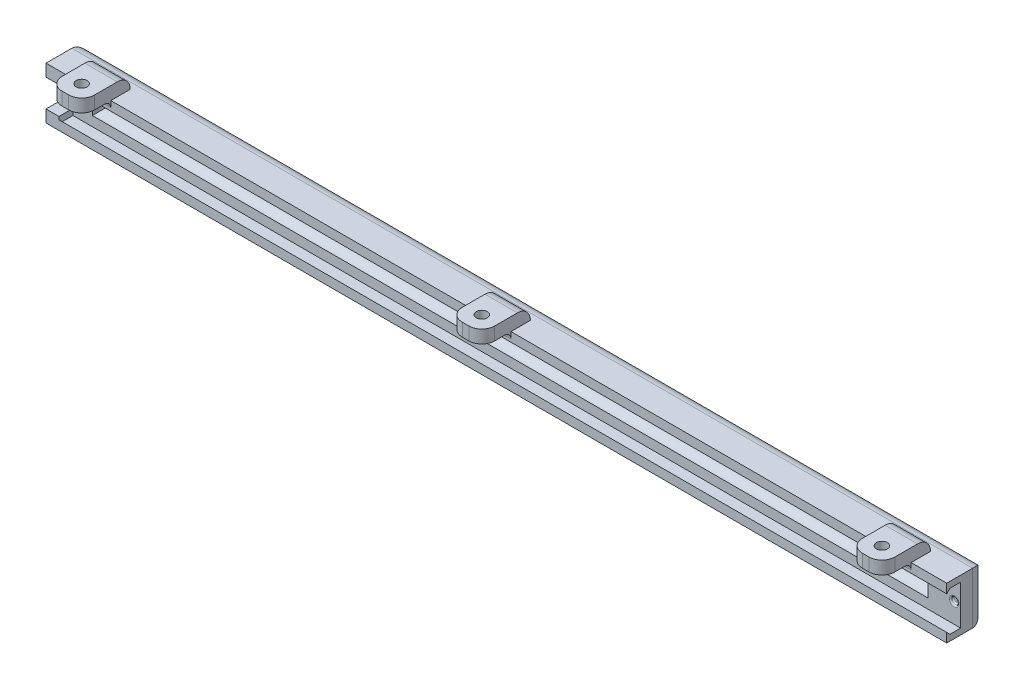
from build123d import *

# Parameters (mm, degrees)
SKETCH1_W               = 278
SKETCH1_H               = 16
BOSS_EXTRUDE1_DEPTH     = 6
CUT_EXTRUDE1_DEPTH      = 283.034214474
CUT_EXTRUDE1_DEPTH_BACK = 274
SKETCH3_W               = 4.3
SKETCH3_H               = 12.3
SKETCH13_W              = 10
SKETCH13_H              = 15
BOSS_EXTRUDE5_DEPTH     = 4
FILLET10_R              = 4
SKETCH14_R              = 1.7
CUT_EXTRUDE5_DEPTH      = 4
FILLET11_R              = 4
FILLET12_R              = 4
FILLET22_R              = 2
SKETCH17_W              = 278
SKETCH17_H              = 16
BOSS_EXTRUDE6_DEPTH     = 6
FILLET25_R              = 4
SKETCH18_R              = 1
CUT_EXTRUDE6_DEPTH      = 0.7
FILLET26_R              = 0.5
FILLET27_R              = 0.5
SKETCH21_W              = 4
SKETCH21_H              = 8.5
CUT_EXTRUDE10_DEPTH     = 4
BOSS_EXTRUDE9_DEPTH     = 274
SKETCH27_W              = 258
SKETCH27_H              = 6.3
CUT_EXTRUDE11_DEPTH     = 3
FILLET30_R              = 3.15
LPATTERN2_START         = 47.151862464
LPATTERN2_OUTLINE_R     = 1.7
LPATTERN2_DEPTH         = 4
LPATTERN2_START_2       = -24.03008596
LPATTERN2_2_DEPTH       = 10
LPATTERN2_START_3       = 99.46991404
LPATTERN2_3_DEPTH       = 10


with BuildPart() as part:
    # Sketch1 → Boss-Extrude1 (new body)
    with BuildSketch(Plane.XY):
        with Locations((-18.53008596, 39.151862464)):
            Rectangle(SKETCH1_W, SKETCH1_H)
    extrude(amount=BOSS_EXTRUDE1_DEPTH)

    # Sketch3 → Cut-Extrude1 (cut, two sides: drawn at the far end of the back side and taken through both)
    with BuildSketch(Plane(origin=(120.46991404, 0, 0), x_dir=(0, 0, -1), z_dir=(1, 0, 0)).offset(-CUT_EXTRUDE1_DEPTH_BACK)):
        with Locations((-3.85, 39.151862464)):
            Rectangle(SKETCH3_W, SKETCH3_H)
    extrude(amount=CUT_EXTRUDE1_DEPTH + CUT_EXTRUDE1_DEPTH_BACK, mode=Mode.SUBTRACT)

    # Sketch13 → Boss-Extrude5 (add)
    with BuildSketch(Plane(origin=(0, 47.151862464, 0), x_dir=(1, 0, 0), z_dir=(0, 1, 0))):
        with Locations((-142.53008596, -7.5)):
            Rectangle(SKETCH13_W, SKETCH13_H)
    extrude(amount=BOSS_EXTRUDE5_DEPTH)

    # Fillet10
    fillet10_edges = [part.edges().sort_by_distance(p)[0] for p in [
        (-142.53008596, 51.151862464, 0),
    ]]
    fillet(fillet10_edges, radius=FILLET10_R)

    # Sketch14 → Cut-Extrude5 (cut)
    with BuildSketch(Plane.XZ.offset(-47.151862464)):
        with Locations(Location((-142.53008596, 10, 0), (0, 0, 270))):
            Circle(SKETCH14_R)
    extrude(amount=-CUT_EXTRUDE5_DEPTH, mode=Mode.SUBTRACT)

    # Fillet11
    fillet11_edges = [part.edges().sort_by_distance(p)[0] for p in [
        (-137.53008596, 49.151862464, 15),
    ]]
    fillet(fillet11_edges, radius=FILLET11_R)

    # Fillet12
    fillet12_edges = [part.edges().sort_by_distance(p)[0] for p in [
        (-147.53008596, 49.151862464, 15),
    ]]
    fillet(fillet12_edges, radius=FILLET12_R)

    # Fillet22
    # the kernel refuses this fillet: 2 mm, written as the material it adds along each edge
    with BuildSketch(Plane(origin=(-147.53008596, 47.151862464, 6), x_dir=(0, 0, 1), z_dir=(1, 0, 0))) as fillet22_piece_1:
        with BuildLine():
            CenterArc((1.994367068, 2), FILLET22_R, 184.301222305, 85.698777695)
            Line((0, 1.85), (0, 0))
            Line((0, 0), (1.994367068, 0))
        make_face()
    extrude(amount=10)

    # Sketch17 → Boss-Extrude6 (add)
    with BuildSketch(Plane(origin=(0, 0, 0), x_dir=(-1, 0, 0), z_dir=(0, 0, -1))):
        with Locations((18.53008596, 39.151862464)):
            Rectangle(SKETCH17_W, SKETCH17_H)
    extrude(amount=BOSS_EXTRUDE6_DEPTH)

    # Fillet25
    fillet25_edges = [part.edges().sort_by_distance(p)[0] for p in [
        (120.46991404, 39.151862464, -6),
        (-18.53008596, 31.151862464, -6),
        (-157.53008596, 39.151862464, -6),
        (-18.53008596, 47.151862464, -6),
    ]]
    fillet(fillet25_edges, radius=FILLET25_R)

    # Sketch18 → Cut-Extrude6 (cut)
    with BuildSketch(Plane.XY.offset(1.7)):
        with Locations((118.46991404, 39.151862464)):
            Circle(SKETCH18_R)
    extrude(amount=-CUT_EXTRUDE6_DEPTH, mode=Mode.SUBTRACT)

    # Fillet26
    fillet26_edges = [part.edges().sort_by_distance(p)[0] for p in [
        (117.46991404, 39.151862464, 1.7),
    ]]
    fillet(fillet26_edges, radius=FILLET26_R)

    # Fillet27
    fillet27_edges = [part.edges().sort_by_distance(p)[0] for p in [
        (117.46991404, 39.151862464, 1),
    ]]
    fillet(fillet27_edges, radius=FILLET27_R)

    # Sketch21 → Cut-Extrude10 (cut)
    with BuildSketch(Plane.ZY.offset(157.53008596)):
        with Locations((4, 39.151862464)):
            Rectangle(SKETCH21_W, SKETCH21_H)
    extrude(amount=-CUT_EXTRUDE10_DEPTH, mode=Mode.SUBTRACT)

    # Sketch26 → Boss-Extrude9 (add)
    with BuildSketch(Plane(origin=(120.46991404, 0, 0), x_dir=(0, 0, -1), z_dir=(1, 0, 0))):
        Polygon((-6, 45.301862464), (-6, 44.301862464), (-5, 45.301862464), align=None)
        Polygon((-6, 33.001862464), (-6, 34.001862464), (-5, 33.001862464), align=None)
    extrude(amount=-BOSS_EXTRUDE9_DEPTH)

    # Sketch27 → Cut-Extrude11 (cut)
    with BuildSketch(Plane.XY.offset(1.7)):
        with Locations((-18.53008596, 39.151862464)):
            Rectangle(SKETCH27_W, SKETCH27_H)
    extrude(amount=-CUT_EXTRUDE11_DEPTH, mode=Mode.SUBTRACT)

    # Fillet30
    # the kernel refuses this fillet: 3.15 mm, written as the material it adds along each edge
    with BuildSketch(Plane(origin=(-155.396152321, 42.301862464, -1.3), x_dir=(0, 0, 1), z_dir=(1, 0, 0)), Plane(origin=(118.335980401, 36.001862464, -1.3), x_dir=(0, 0, 1), z_dir=(-1, 0, 0))) as fillet30_piece_1:
        with BuildLine():
            CenterArc((3.15, 3.146426545), FILLET30_R, 180, 87.270597363)
            Line((0, 3.146426545), (0, 0))
            Line((0, 0), (3, 0))
        make_face()
    extrude(amount=273.732132723)
    with BuildSketch(Plane(origin=(110.46991404, 50.167928825, -1.3), x_dir=(0, 0, 1), z_dir=(0, -1, 0))) as fillet30_piece_2_section:
        with BuildLine():
            CenterArc((3.15, 3.146426545), FILLET30_R, 180, 87.270597363)
            Line((0, 3.146426545), (0, 0))
            Line((0, 0), (3, 0))
        make_face()
    fillet30_piece_2 = extrude(amount=22.032132723, mode=Mode.PRIVATE)
    fillet30_piece_2 = split(fillet30_piece_2, bisect_by=Plane(origin=(110.46991404, 31.151862464, -1.3), z_dir=(0, 1, 0)), keep=Keep.TOP, mode=Mode.PRIVATE)
    fillet30_piece_2 = split(fillet30_piece_2, bisect_by=Plane(origin=(110.46991404, 47.151862464, -1.3), z_dir=(0, -1, 0)), keep=Keep.TOP, mode=Mode.PRIVATE)
    add(fillet30_piece_2)
    with BuildSketch(Plane(origin=(-147.53008596, 28.135796103, -1.3), x_dir=(0, 0, 1), z_dir=(0, 1, 0))) as fillet30_piece_3_section:
        with BuildLine():
            CenterArc((3.15, 3.146426545), FILLET30_R, 180, 87.270597363)
            Line((0, 3.146426545), (0, 0))
            Line((0, 0), (3, 0))
        make_face()
    fillet30_piece_3 = extrude(amount=22.032132723, mode=Mode.PRIVATE)
    fillet30_piece_3 = split(fillet30_piece_3, bisect_by=Plane(origin=(-147.53008596, 31.151862464, -1.3), z_dir=(0, 1, 0)), keep=Keep.TOP, mode=Mode.PRIVATE)
    fillet30_piece_3 = split(fillet30_piece_3, bisect_by=Plane(origin=(-147.53008596, 47.151862464, -1.3), z_dir=(0, -1, 0)), keep=Keep.TOP, mode=Mode.PRIVATE)
    add(fillet30_piece_3)

    # LPattern2: read off the stored shape, not the designer's step
    # LPattern2 outline → LPattern2 (add)
    # profile 1 of 2: a face of its own
    with BuildSketch(Plane(origin=(0, 0, 0), x_dir=(1, 0, 0), z_dir=(0, 1, 0)).offset(LPATTERN2_START)):
        with BuildLine():
            Line((-14.03008596, -11), (-14.03008596, -6))
            Line((-14.03008596, -6), (-24.03008596, -6))
            Line((-24.03008596, -6), (-24.03008596, -11))
            ThreePointArc((-24.03008596, -11), (-22.858513085, -13.828427125), (-20.03008596, -15))
            Line((-20.03008596, -15), (-18.03008596, -15))
            ThreePointArc((-18.03008596, -15), (-15.201658835, -13.828427125), (-14.03008596, -11))
        make_face()
        with Locations((-19.03008596, -10)):
            Circle(LPATTERN2_OUTLINE_R, mode=Mode.SUBTRACT)
    # profile 2 of 2: a face of its own
    with BuildSketch(Plane(origin=(0, 0, 0), x_dir=(1, 0, 0), z_dir=(0, 1, 0)).offset(LPATTERN2_START)):
        with BuildLine():
            Line((103.46991404, -15), (105.46991404, -15))
            ThreePointArc((105.46991404, -15), (108.298341165, -13.828427125), (109.46991404, -11))
            Line((109.46991404, -11), (109.46991404, -6))
            Line((109.46991404, -6), (99.46991404, -6))
            Line((99.46991404, -6), (99.46991404, -11))
            ThreePointArc((99.46991404, -11), (100.641486915, -13.828427125), (103.46991404, -15))
        make_face()
        with Locations((104.46991404, -10)):
            Circle(LPATTERN2_OUTLINE_R, mode=Mode.SUBTRACT)
    extrude(amount=LPATTERN2_DEPTH)

    # LPattern2 2 outline → LPattern2 2 (add)
    with BuildSketch(Plane.YZ.offset(LPATTERN2_START_2)):
        with BuildLine():
            Line((45.151862464, 6), (47.151862464, 6))
            Line((47.151862464, 6), (47.151862464, 8))
            ThreePointArc((47.151862464, 8), (46.566076026, 6.585786437), (45.151862464, 6))
        make_face()
        with BuildLine():
            Line((51.151862464, 4), (51.151862464, 6))
            Line((51.151862464, 6), (47.151862464, 6))
            Line((47.151862464, 6), (47.151862464, 0))
            ThreePointArc((47.151862464, 0), (49.980289589, 1.171572875), (51.151862464, 4))
        make_face()
    extrude(amount=LPATTERN2_2_DEPTH)

    # LPattern2 3 outline → LPattern2 3 (add)
    with BuildSketch(Plane.YZ.offset(LPATTERN2_START_3)):
        with BuildLine():
            Line((45.151862464, 6), (47.151862464, 6))
            Line((47.151862464, 6), (47.151862464, 8))
            ThreePointArc((47.151862464, 8), (46.566076026, 6.585786437), (45.151862464, 6))
        make_face()
        with BuildLine():
            Line((51.151862464, 4), (51.151862464, 6))
            Line((51.151862464, 6), (47.151862464, 6))
            Line((47.151862464, 6), (47.151862464, 0))
            ThreePointArc((47.151862464, 0), (49.980289589, 1.171572875), (51.151862464, 4))
        make_face()
    extrude(amount=LPATTERN2_3_DEPTH)


solid = part.part
